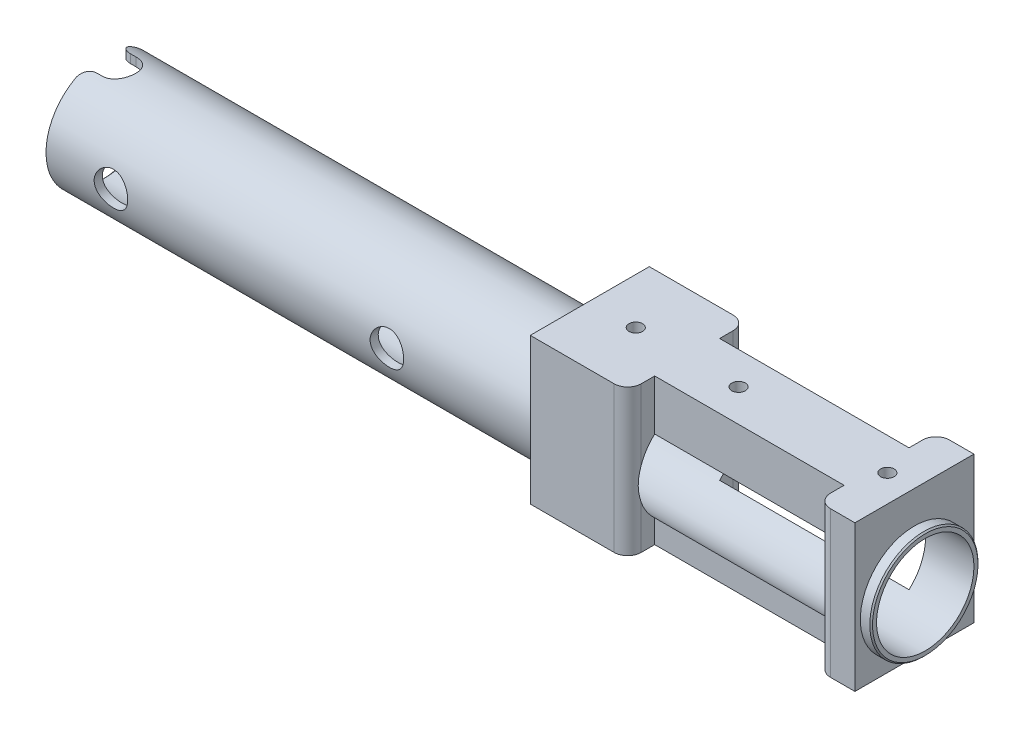
from build123d import *

# Parameters (mm, degrees)
SKETCH_1_W               = 22
SKETCH_1_H               = 27
EXTRUDE_1_DEPTH          = 152
SKETCH_2_R               = 9
CUT_EXTRUDE_1_DEPTH      = 152
SKETCH_3_W               = 26.198960086
SKETCH_3_H               = 33.961614926
SKETCH_3_R               = 10
CUT_EXTRUDE_2_DEPTH      = 2
SKETCH_4_W               = 27.16929194
SKETCH_4_H               = 37.260743233
SKETCH_4_R               = 10.5
CUT_EXTRUDE_3_DEPTH      = 90
SKETCH_5_W               = 35
SKETCH_5_H               = 10.666340091
CUT_EXTRUDE_4_DEPTH      = 90
FILLET_2_R               = 2.5
CHAMFER_1_SIZE           = 0.5
CUT_EXTRUDE_5_DEPTH      = 21
FILLET_3_R               = 2
CUT_EXTRUDE_6_DEPTH      = 155.176035873
CUT_EXTRUDE_6_DEPTH_BACK = 155.176035873
SKETCH_7_R               = 3.1
HOLE_WIZARD_M3_1_D       = 2.5
HOLE_WIZARD_M3_1_DEPTH   = 5
HOLE_WIZARD_M3_1_TIP     = 0.751075774
CHAMFER_2_SIZE           = 0.25
HOLE_WIZARD_M3_2_D       = 2.5
HOLE_WIZARD_M3_2_DEPTH   = 5
HOLE_WIZARD_M3_2_TIP     = 0.751075774


with BuildPart() as part:
    # 草图1 → 凸台-拉伸1 (new body)
    with BuildSketch(Plane(origin=(0, 0, 0), x_dir=(0, 0, -1), z_dir=(1, 0, 0))):
        Rectangle(SKETCH_1_W, SKETCH_1_H)
    extrude(amount=EXTRUDE_1_DEPTH)

    # 草图2 → 切除-拉伸1 (cut)
    with BuildSketch(Plane(origin=(152, 0, 0), x_dir=(0, 0, -1), z_dir=(1, 0, 0))):
        with Locations((0, -2.5)):
            Circle(SKETCH_2_R)
    extrude(amount=-CUT_EXTRUDE_1_DEPTH, mode=Mode.SUBTRACT)

    # 草图3 → 切除-拉伸2 (cut)
    with BuildSketch(Plane(origin=(152, 0, 0), x_dir=(0, 0, -1), z_dir=(1, 0, 0))):
        with Locations((0, 1.859802722)):
            Rectangle(SKETCH_3_W, SKETCH_3_H)
        with Locations((0, -2.5)):
            Circle(SKETCH_3_R, mode=Mode.SUBTRACT)
    extrude(amount=-CUT_EXTRUDE_2_DEPTH, mode=Mode.SUBTRACT)

    # 草图4 → 切除-拉伸3 (cut)
    with BuildSketch(Plane.ZY):
        with Locations((0, 2.328796452)):
            Rectangle(SKETCH_4_W, SKETCH_4_H)
        with Locations((0, -2.5)):
            Circle(SKETCH_4_R, mode=Mode.SUBTRACT)
    extrude(amount=-CUT_EXTRUDE_3_DEPTH, mode=Mode.SUBTRACT)

    # 草图5 → 切除-拉伸4 (cut)
    with BuildSketch(Plane(origin=(0, 13.5, 0), x_dir=(1, 0, 0), z_dir=(0, 1, 0))):
        with Locations((125.5, 11.333170046)):
            Rectangle(SKETCH_5_W, SKETCH_5_H)
        with Locations((125.5, -11.333170046)):
            Rectangle(SKETCH_5_W, SKETCH_5_H)
    extrude(amount=-CUT_EXTRUDE_4_DEPTH, mode=Mode.SUBTRACT)

    # 圆角2
    # the kernel refuses this fillet: 2.5 mm, written as the material it adds along each edge
    with BuildSketch(Plane(origin=(143, -2.958203932, 6), x_dir=(0, 0, 1), z_dir=(0, -1, 0))) as fillet_2_piece_1_section:
        with BuildLine():
            CenterArc((FILLET_2_R, FILLET_2_R), FILLET_2_R, 180, 90)
            Line((0, FILLET_2_R), (0, 0))
            Line((0, 0), (FILLET_2_R, 0))
        make_face()
    fillet_2_piece_1 = extrude(amount=10.541796068, mode=Mode.PRIVATE)
    fillet_2_piece_1 = fillet_2_piece_1 - Plane(origin=(142.474716749, -2.5, 0), x_dir=(0, 0, -1), z_dir=(1, 0, 0)) * Cylinder(9, 32, mode=Mode.PRIVATE)
    add(fillet_2_piece_1)
    # the kernel refuses this fillet: 2.5 mm, written as the material it takes off along each edge
    with BuildSketch(Plane(origin=(143, 19.75, 11), x_dir=(1, 0, 0), z_dir=(0, -1, 0)), Plane(origin=(143, 19.75, -11), x_dir=(0, 0, 1), z_dir=(0, -1, 0))) as fillet_2_2_piece_1:
        with BuildLine():
            CenterArc((FILLET_2_R, -FILLET_2_R), FILLET_2_R, 90, 90)
            Line((0, -FILLET_2_R), (0, 0))
            Line((0, 0), (FILLET_2_R, 0))
        make_face()
    extrude(amount=39.5, mode=Mode.SUBTRACT)
    with BuildSketch(Plane(origin=(108, -19.75, 11), x_dir=(0, 0, -1), z_dir=(0, 1, 0)), Plane(origin=(108, -19.75, -11), x_dir=(-1, 0, 0), z_dir=(0, 1, 0))) as fillet_2_2_piece_2:
        with BuildLine():
            CenterArc((FILLET_2_R, FILLET_2_R), FILLET_2_R, 180, 90)
            Line((0, FILLET_2_R), (0, 0))
            Line((0, 0), (FILLET_2_R, 0))
        make_face()
    extrude(amount=39.5, mode=Mode.SUBTRACT)

    # 倒角1
    chamfer_1_edges = [part.edges().sort_by_distance(p)[0] for p in [
        (0, -2.5, 9),
    ]]
    chamfer(chamfer_1_edges, length=CHAMFER_1_SIZE)

    # 草图6 → 切除-拉伸5 (cut)
    with BuildSketch(Plane(origin=(0, 0, 0), x_dir=(1, 0, 0), z_dir=(0, 1, 0))):
        with BuildLine():
            Line((3, -3.1), (0, -3.1))
            Line((0, -3.1), (0, 3.1))
            Line((0, 3.1), (3, 3.1))
            ThreePointArc((3, 3.1), (6.1, 0), (3, -3.1))
        make_face()
    extrude(amount=CUT_EXTRUDE_5_DEPTH, mode=Mode.SUBTRACT)

    # 圆角3
    # the kernel refuses this fillet: 2 mm, written as the material it takes off along each edge
    with BuildSketch(Plane(origin=(0, 1.479977728, 3.1), x_dir=(0, 0, 1), z_dir=(0, 1, 0))) as fillet_3_piece_1:
        with BuildLine():
            CenterArc((FILLET_3_R, FILLET_3_R), FILLET_3_R, 180, 90)
            Line((0, FILLET_3_R), (0, 0))
            Line((0, 0), (FILLET_3_R, 0))
        make_face()
    extrude(amount=11.051971235, mode=Mode.SUBTRACT)
    with BuildSketch(Plane(origin=(0, 1.479977728, -3.1), x_dir=(0, 0, -1), z_dir=(0, 1, 0))) as fillet_3_piece_2:
        with BuildLine():
            CenterArc((FILLET_3_R, -FILLET_3_R), FILLET_3_R, 90, 90)
            Line((0, -FILLET_3_R), (0, 0))
            Line((0, 0), (FILLET_3_R, 0))
        make_face()
    extrude(amount=11.051971235, mode=Mode.SUBTRACT)

    # 草图7 → 切除-拉伸6 (cut, two sides: drawn at the far end of the back side and taken through both)
    with BuildSketch(Plane.XY.offset(11).offset(-CUT_EXTRUDE_6_DEPTH_BACK)):
        with Locations((12, -2.5)):
            Circle(SKETCH_7_R)
        with Locations((63, -2.5)):
            Circle(SKETCH_7_R)
    extrude(amount=CUT_EXTRUDE_6_DEPTH + CUT_EXTRUDE_6_DEPTH_BACK, mode=Mode.SUBTRACT)

    # M3 螺纹孔1
    with Locations(Plane(origin=(0, 13.5, 0), x_dir=(1, 0, 0), z_dir=(0, 1, 0))):
        with Locations((98.5, 0), (117.5, 0), (145, 0)):
            Hole(HOLE_WIZARD_M3_1_D / 2, depth=HOLE_WIZARD_M3_1_DEPTH)
            with Locations((0, 0, -(HOLE_WIZARD_M3_1_DEPTH + HOLE_WIZARD_M3_1_TIP / 2))):  # 118° drill point
                Cone(0, HOLE_WIZARD_M3_1_D / 2, HOLE_WIZARD_M3_1_TIP, mode=Mode.SUBTRACT)

    # 倒角2
    chamfer_2_edges = [part.edges().sort_by_distance(p)[0] for p in [
        (152, -2.5, 10),
    ]]
    chamfer(chamfer_2_edges, length=CHAMFER_2_SIZE)

    # M3 螺纹孔2
    with Locations(Plane(origin=(0, -13.5, 0), x_dir=(-1, 0, 0), z_dir=(0, -1, 0))):
        with Locations((-92, -9), (-92, 9), (-148, 9), (-148, -9)):
            Hole(HOLE_WIZARD_M3_2_D / 2, depth=HOLE_WIZARD_M3_2_DEPTH)
            with Locations((0, 0, -(HOLE_WIZARD_M3_2_DEPTH + HOLE_WIZARD_M3_2_TIP / 2))):  # 118° drill point
                Cone(0, HOLE_WIZARD_M3_2_D / 2, HOLE_WIZARD_M3_2_TIP, mode=Mode.SUBTRACT)


solid = part.part
